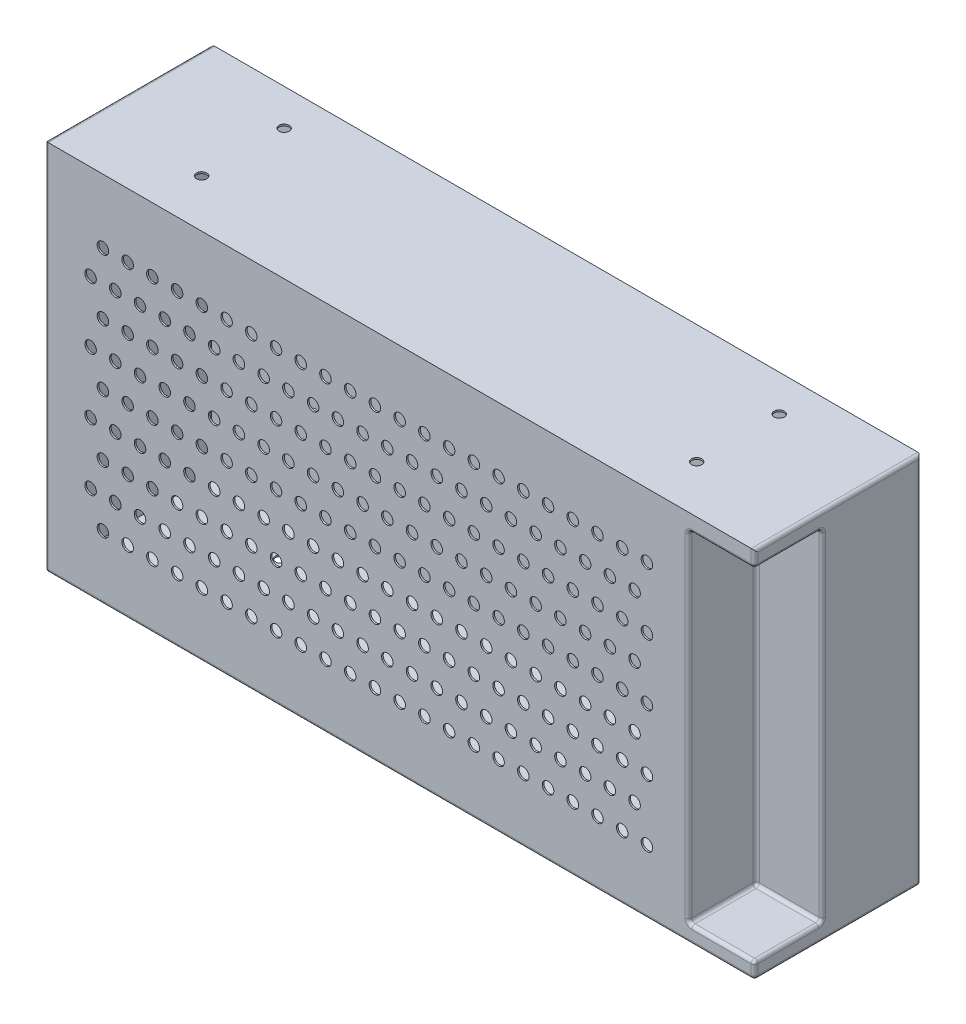
from build123d import *

# Parameters (mm, degrees)
CROQUIS1_W                  = 215
CROQUIS1_H                  = 113
SALIENTE_EXTRUIR1_DEPTH     = 50
CROQUIS2_W                  = 20
CROQUIS2_H                  = 103
CORTAR_EXTRUIR1_DEPTH       = 20
VACIADO1_START              = -107
VACIADO1_OUTLINE_W          = 112
VACIADO1_OUTLINE_H          = 49.5
VACIADO1_DEPTH              = 194
VACIADO1_START_2            = 87
VACIADO1_2_DEPTH            = 20
SALIENTE_EXTRUIR2_DEPTH     = 0.5
CROQUIS5_R                  = 1.75
CORTAR_EXTRUIR2_DEPTH       = 1
PATR_N_START                = 50
PATR_N_DE_RAYADO1_OUTLINE_R = 1.75
PATR_N_DE_RAYADO1_DEPTH     = 0.5
CROQUIS6_R                  = 1.6
CORTAR_EXTRUIR3_DEPTH       = 0.5
CROQUIS7_R                  = 1.55
CORTAR_EXTRUIR4_DEPTH       = 0.5
MATRIZL1_COUNT              = 2
MATRIZL1_PITCH              = 150
MATRIZL1_COUNT_DIR2         = 2
MATRIZL1_PITCH_DIR2         = 25
CROQUIS8_R                  = 1.6
CORTAR_EXTRUIR5_DEPTH       = 0.5
MATRIZL2_COUNT              = 2
MATRIZL2_PITCH              = 150
MATRIZL2_COUNT_DIR2         = 2
MATRIZL2_PITCH_DIR2         = 50
REDONDEO1_R                 = 1


# Read off the part's stored shape, not the designer's step: Vaciado1, Patrón de rayado1
with BuildPart() as part:
    # Croquis1 → Saliente-Extruir1 (new body)
    with BuildSketch(Plane.XY):
        Rectangle(CROQUIS1_W, CROQUIS1_H)
    extrude(amount=SALIENTE_EXTRUIR1_DEPTH)

    # Croquis2 → Cortar-Extruir1 (cut)
    with BuildSketch(Plane(origin=(107.5, 0, 0), x_dir=(0, 0, -1), z_dir=(1, 0, 0))):
        with Locations((-40, 0)):
            Rectangle(CROQUIS2_W, CROQUIS2_H)
    extrude(amount=-CORTAR_EXTRUIR1_DEPTH, mode=Mode.SUBTRACT)

    # Vaciado1 outline → Vaciado1 (cut)
    with BuildSketch(Plane.YZ.offset(VACIADO1_START)):
        with Locations((0, 25.25)):
            Rectangle(VACIADO1_OUTLINE_W, VACIADO1_OUTLINE_H)
    extrude(amount=VACIADO1_DEPTH, mode=Mode.SUBTRACT)

    # Vaciado1 2 outline → Vaciado1 2 (cut)
    with BuildSketch(Plane.YZ.offset(VACIADO1_START_2)):
        Polygon((-56, 50), (-56, 0.5), (56, 0.5), (56, 50), (52, 50), (52, 29.5), (-52, 29.5), (-52, 50), align=None)
    extrude(amount=VACIADO1_2_DEPTH, mode=Mode.SUBTRACT)

    # Croquis4 → Saliente-Extruir2 (add)
    with BuildSketch(Plane.XY.offset(50)):
        Polygon((-107.5, 56.5), (107.5, 56.5), (107.5, 51.5), (87.5, 51.5), (87.5, -51.5), (107.5, -51.5), (107.5, -56.5), (-107.5, -56.5), align=None)
    extrude(amount=SALIENTE_EXTRUIR2_DEPTH)

    # Croquis5 → Cortar-Extruir2 (cut)
    with BuildSketch(Plane.XY.offset(50.5)):
        Circle(CROQUIS5_R)
    extrude(amount=-CORTAR_EXTRUIR2_DEPTH, mode=Mode.SUBTRACT)

    # Patrón de rayado1 outline → Patrón de rayado1 (cut)
    with BuildSketch(Plane.XY.offset(PATR_N_START)):
        with Locations((-93.651648354, 27.815515637)):
            Circle(PATR_N_DE_RAYADO1_OUTLINE_R)
        with Locations((37.460659342, -37.087354183)):
            Circle(PATR_N_DE_RAYADO1_OUTLINE_R)
        with Locations((59.937054947, 37.087354183)):
            Circle(PATR_N_DE_RAYADO1_OUTLINE_R)
        with Locations((56.190989012, 27.815515637)):
            Circle(PATR_N_DE_RAYADO1_OUTLINE_R)
        with Locations((52.444923078, 18.543677091)):
            Circle(PATR_N_DE_RAYADO1_OUTLINE_R)
        with Locations((41.206725276, -27.815515637)):
            Circle(PATR_N_DE_RAYADO1_OUTLINE_R)
        with Locations((44.95279121, -18.543677091)):
            Circle(PATR_N_DE_RAYADO1_OUTLINE_R)
        with Locations((48.698857144, -9.271838546)):
            Circle(PATR_N_DE_RAYADO1_OUTLINE_R)
        with Locations((52.444923078, 0)):
            Circle(PATR_N_DE_RAYADO1_OUTLINE_R)
        with Locations((48.698857144, 27.815515637)):
            Circle(PATR_N_DE_RAYADO1_OUTLINE_R)
        with Locations((52.444923078, 37.087354183)):
            Circle(PATR_N_DE_RAYADO1_OUTLINE_R)
        with Locations((29.968527473, -37.087354183)):
            Circle(PATR_N_DE_RAYADO1_OUTLINE_R)
        with Locations((33.714593407, -27.815515637)):
            Circle(PATR_N_DE_RAYADO1_OUTLINE_R)
        with Locations((37.460659342, -18.543677091)):
            Circle(PATR_N_DE_RAYADO1_OUTLINE_R)
        with Locations((41.206725276, -9.271838546)):
            Circle(PATR_N_DE_RAYADO1_OUTLINE_R)
        with Locations((44.95279121, 0)):
            Circle(PATR_N_DE_RAYADO1_OUTLINE_R)
        with Locations((48.698857144, 9.271838546)):
            Circle(PATR_N_DE_RAYADO1_OUTLINE_R)
        with Locations((59.937054947, 0)):
            Circle(PATR_N_DE_RAYADO1_OUTLINE_R)
        with Locations((63.683120881, 9.271838546)):
            Circle(PATR_N_DE_RAYADO1_OUTLINE_R)
        with Locations((67.429186815, 18.543677091)):
            Circle(PATR_N_DE_RAYADO1_OUTLINE_R)
        with Locations((71.175252749, 27.815515637)):
            Circle(PATR_N_DE_RAYADO1_OUTLINE_R)
        with Locations((59.937054947, -18.543677091)):
            Circle(PATR_N_DE_RAYADO1_OUTLINE_R)
        with Locations((56.190989012, -27.815515637)):
            Circle(PATR_N_DE_RAYADO1_OUTLINE_R)
        with Locations((52.444923078, -37.087354183)):
            Circle(PATR_N_DE_RAYADO1_OUTLINE_R)
        with Locations((74.921318683, 37.087354183)):
            Circle(PATR_N_DE_RAYADO1_OUTLINE_R)
        with Locations((56.190989012, -9.271838546)):
            Circle(PATR_N_DE_RAYADO1_OUTLINE_R)
        with Locations((52.444923078, -18.543677091)):
            Circle(PATR_N_DE_RAYADO1_OUTLINE_R)
        with Locations((48.698857144, -27.815515637)):
            Circle(PATR_N_DE_RAYADO1_OUTLINE_R)
        with Locations((44.95279121, -37.087354183)):
            Circle(PATR_N_DE_RAYADO1_OUTLINE_R)
        with Locations((67.429186815, 37.087354183)):
            Circle(PATR_N_DE_RAYADO1_OUTLINE_R)
        with Locations((63.683120881, 27.815515637)):
            Circle(PATR_N_DE_RAYADO1_OUTLINE_R)
        with Locations((59.937054947, 18.543677091)):
            Circle(PATR_N_DE_RAYADO1_OUTLINE_R)
        with Locations((56.190989012, 9.271838546)):
            Circle(PATR_N_DE_RAYADO1_OUTLINE_R)
        with Locations((37.460659342, 37.087354183)):
            Circle(PATR_N_DE_RAYADO1_OUTLINE_R)
        with Locations((33.714593407, 27.815515637)):
            Circle(PATR_N_DE_RAYADO1_OUTLINE_R)
        with Locations((29.968527473, 18.543677091)):
            Circle(PATR_N_DE_RAYADO1_OUTLINE_R)
        with Locations((26.222461539, 9.271838546)):
            Circle(PATR_N_DE_RAYADO1_OUTLINE_R)
        with Locations((22.476395605, 0)):
            Circle(PATR_N_DE_RAYADO1_OUTLINE_R)
        with Locations((18.730329671, -9.271838546)):
            Circle(PATR_N_DE_RAYADO1_OUTLINE_R)
        with Locations((14.984263737, -18.543677091)):
            Circle(PATR_N_DE_RAYADO1_OUTLINE_R)
        with Locations((11.238197802, -27.815515637)):
            Circle(PATR_N_DE_RAYADO1_OUTLINE_R)
        with Locations((7.492131868, -18.543677091)):
            Circle(PATR_N_DE_RAYADO1_OUTLINE_R)
        with Locations((11.238197802, -9.271838546)):
            Circle(PATR_N_DE_RAYADO1_OUTLINE_R)
        with Locations((14.984263737, 0)):
            Circle(PATR_N_DE_RAYADO1_OUTLINE_R)
        with Locations((18.730329671, 9.271838546)):
            Circle(PATR_N_DE_RAYADO1_OUTLINE_R)
        with Locations((7.492131868, -37.087354183)):
            Circle(PATR_N_DE_RAYADO1_OUTLINE_R)
        with Locations((29.968527473, 37.087354183)):
            Circle(PATR_N_DE_RAYADO1_OUTLINE_R)
        with Locations((26.222461539, 27.815515637)):
            Circle(PATR_N_DE_RAYADO1_OUTLINE_R)
        with Locations((22.476395605, 18.543677091)):
            Circle(PATR_N_DE_RAYADO1_OUTLINE_R)
        with Locations((29.968527473, -18.543677091)):
            Circle(PATR_N_DE_RAYADO1_OUTLINE_R)
        with Locations((26.222461539, -27.815515637)):
            Circle(PATR_N_DE_RAYADO1_OUTLINE_R)
        with Locations((22.476395605, -37.087354183)):
            Circle(PATR_N_DE_RAYADO1_OUTLINE_R)
        with Locations((44.95279121, 37.087354183)):
            Circle(PATR_N_DE_RAYADO1_OUTLINE_R)
        with Locations((33.714593407, -9.271838546)):
            Circle(PATR_N_DE_RAYADO1_OUTLINE_R)
        with Locations((37.460659342, 0)):
            Circle(PATR_N_DE_RAYADO1_OUTLINE_R)
        with Locations((41.206725276, 9.271838546)):
            Circle(PATR_N_DE_RAYADO1_OUTLINE_R)
        with Locations((44.95279121, 18.543677091)):
            Circle(PATR_N_DE_RAYADO1_OUTLINE_R)
        with Locations((41.206725276, 27.815515637)):
            Circle(PATR_N_DE_RAYADO1_OUTLINE_R)
        with Locations((37.460659342, 18.543677091)):
            Circle(PATR_N_DE_RAYADO1_OUTLINE_R)
        with Locations((33.714593407, 9.271838546)):
            Circle(PATR_N_DE_RAYADO1_OUTLINE_R)
        with Locations((29.968527473, 0)):
            Circle(PATR_N_DE_RAYADO1_OUTLINE_R)
        with Locations((26.222461539, -9.271838546)):
            Circle(PATR_N_DE_RAYADO1_OUTLINE_R)
        with Locations((22.476395605, -18.543677091)):
            Circle(PATR_N_DE_RAYADO1_OUTLINE_R)
        with Locations((18.730329671, -27.815515637)):
            Circle(PATR_N_DE_RAYADO1_OUTLINE_R)
        with Locations((14.984263737, -37.087354183)):
            Circle(PATR_N_DE_RAYADO1_OUTLINE_R)
        with Locations((74.921318683, -18.543677091)):
            Circle(PATR_N_DE_RAYADO1_OUTLINE_R)
        with Locations((71.175252749, -27.815515637)):
            Circle(PATR_N_DE_RAYADO1_OUTLINE_R)
        with Locations((67.429186815, -37.087354183)):
            Circle(PATR_N_DE_RAYADO1_OUTLINE_R)
        with Locations((74.921318683, 0)):
            Circle(PATR_N_DE_RAYADO1_OUTLINE_R)
        with Locations((74.921318683, -37.087354183)):
            Circle(PATR_N_DE_RAYADO1_OUTLINE_R)
        with Locations((63.683120881, -9.271838546)):
            Circle(PATR_N_DE_RAYADO1_OUTLINE_R)
        with Locations((67.429186815, 0)):
            Circle(PATR_N_DE_RAYADO1_OUTLINE_R)
        with Locations((71.175252749, 9.271838546)):
            Circle(PATR_N_DE_RAYADO1_OUTLINE_R)
        with Locations((74.921318683, 18.543677091)):
            Circle(PATR_N_DE_RAYADO1_OUTLINE_R)
        with Locations((59.937054947, -37.087354183)):
            Circle(PATR_N_DE_RAYADO1_OUTLINE_R)
        with Locations((63.683120881, -27.815515637)):
            Circle(PATR_N_DE_RAYADO1_OUTLINE_R)
        with Locations((67.429186815, -18.543677091)):
            Circle(PATR_N_DE_RAYADO1_OUTLINE_R)
        with Locations((71.175252749, -9.271838546)):
            Circle(PATR_N_DE_RAYADO1_OUTLINE_R)
        with Locations((-63.683120881, -9.271838546)):
            Circle(PATR_N_DE_RAYADO1_OUTLINE_R)
        with Locations((-59.937054947, 0)):
            Circle(PATR_N_DE_RAYADO1_OUTLINE_R)
        with Locations((-56.190989012, 9.271838546)):
            Circle(PATR_N_DE_RAYADO1_OUTLINE_R)
        with Locations((-52.444923078, 18.543677091)):
            Circle(PATR_N_DE_RAYADO1_OUTLINE_R)
        with Locations((-48.698857144, 27.815515637)):
            Circle(PATR_N_DE_RAYADO1_OUTLINE_R)
        with Locations((-44.95279121, 37.087354183)):
            Circle(PATR_N_DE_RAYADO1_OUTLINE_R)
        with Locations((-67.429186815, -37.087354183)):
            Circle(PATR_N_DE_RAYADO1_OUTLINE_R)
        with Locations((-63.683120881, -27.815515637)):
            Circle(PATR_N_DE_RAYADO1_OUTLINE_R)
        with Locations((-67.429186815, 0)):
            Circle(PATR_N_DE_RAYADO1_OUTLINE_R)
        with Locations((-63.683120881, 9.271838546)):
            Circle(PATR_N_DE_RAYADO1_OUTLINE_R)
        with Locations((-59.937054947, 18.543677091)):
            Circle(PATR_N_DE_RAYADO1_OUTLINE_R)
        with Locations((-56.190989012, 27.815515637)):
            Circle(PATR_N_DE_RAYADO1_OUTLINE_R)
        with Locations((-67.429186815, -18.543677091)):
            Circle(PATR_N_DE_RAYADO1_OUTLINE_R)
        with Locations((-71.175252749, -27.815515637)):
            Circle(PATR_N_DE_RAYADO1_OUTLINE_R)
        with Locations((-74.921318683, -37.087354183)):
            Circle(PATR_N_DE_RAYADO1_OUTLINE_R)
        with Locations((-52.444923078, 37.087354183)):
            Circle(PATR_N_DE_RAYADO1_OUTLINE_R)
        with Locations((-29.968527473, 37.087354183)):
            Circle(PATR_N_DE_RAYADO1_OUTLINE_R)
        with Locations((-33.714593407, 27.815515637)):
            Circle(PATR_N_DE_RAYADO1_OUTLINE_R)
        with Locations((-37.460659342, 18.543677091)):
            Circle(PATR_N_DE_RAYADO1_OUTLINE_R)
        with Locations((-41.206725276, 9.271838546)):
            Circle(PATR_N_DE_RAYADO1_OUTLINE_R)
        with Locations((-44.95279121, 0)):
            Circle(PATR_N_DE_RAYADO1_OUTLINE_R)
        with Locations((-48.698857144, -9.271838546)):
            Circle(PATR_N_DE_RAYADO1_OUTLINE_R)
        with Locations((-52.444923078, -18.543677091)):
            Circle(PATR_N_DE_RAYADO1_OUTLINE_R)
        with Locations((-56.190989012, -27.815515637)):
            Circle(PATR_N_DE_RAYADO1_OUTLINE_R)
        with Locations((-59.937054947, -18.543677091)):
            Circle(PATR_N_DE_RAYADO1_OUTLINE_R)
        with Locations((-56.190989012, -9.271838546)):
            Circle(PATR_N_DE_RAYADO1_OUTLINE_R)
        with Locations((-52.444923078, 0)):
            Circle(PATR_N_DE_RAYADO1_OUTLINE_R)
        with Locations((-48.698857144, 9.271838546)):
            Circle(PATR_N_DE_RAYADO1_OUTLINE_R)
        with Locations((-59.937054947, -37.087354183)):
            Circle(PATR_N_DE_RAYADO1_OUTLINE_R)
        with Locations((-37.460659342, 37.087354183)):
            Circle(PATR_N_DE_RAYADO1_OUTLINE_R)
        with Locations((-41.206725276, 27.815515637)):
            Circle(PATR_N_DE_RAYADO1_OUTLINE_R)
        with Locations((-44.95279121, 18.543677091)):
            Circle(PATR_N_DE_RAYADO1_OUTLINE_R)
        with Locations((-93.651648354, -27.815515637)):
            Circle(PATR_N_DE_RAYADO1_OUTLINE_R)
        with Locations((-74.921318683, 37.087354183)):
            Circle(PATR_N_DE_RAYADO1_OUTLINE_R)
        with Locations((-78.667384617, 27.815515637)):
            Circle(PATR_N_DE_RAYADO1_OUTLINE_R)
        with Locations((-82.413450552, 18.543677091)):
            Circle(PATR_N_DE_RAYADO1_OUTLINE_R)
        with Locations((-89.90558242, -18.543677091)):
            Circle(PATR_N_DE_RAYADO1_OUTLINE_R)
        with Locations((-86.159516486, -9.271838546)):
            Circle(PATR_N_DE_RAYADO1_OUTLINE_R)
        with Locations((-82.413450552, 0)):
            Circle(PATR_N_DE_RAYADO1_OUTLINE_R)
        with Locations((-78.667384617, 9.271838546)):
            Circle(PATR_N_DE_RAYADO1_OUTLINE_R)
        with Locations((-86.159516486, 27.815515637)):
            Circle(PATR_N_DE_RAYADO1_OUTLINE_R)
        with Locations((-89.90558242, 18.543677091)):
            Circle(PATR_N_DE_RAYADO1_OUTLINE_R)
        with Locations((-93.651648354, 9.271838546)):
            Circle(PATR_N_DE_RAYADO1_OUTLINE_R)
        with Locations((-89.90558242, 37.087354183)):
            Circle(PATR_N_DE_RAYADO1_OUTLINE_R)
        with Locations((-86.159516486, 9.271838546)):
            Circle(PATR_N_DE_RAYADO1_OUTLINE_R)
        with Locations((-89.90558242, 0)):
            Circle(PATR_N_DE_RAYADO1_OUTLINE_R)
        with Locations((-93.651648354, -9.271838546)):
            Circle(PATR_N_DE_RAYADO1_OUTLINE_R)
        with Locations((-82.413450552, 37.087354183)):
            Circle(PATR_N_DE_RAYADO1_OUTLINE_R)
        with Locations((-71.175252749, -9.271838546)):
            Circle(PATR_N_DE_RAYADO1_OUTLINE_R)
        with Locations((-74.921318683, -18.543677091)):
            Circle(PATR_N_DE_RAYADO1_OUTLINE_R)
        with Locations((-78.667384617, -27.815515637)):
            Circle(PATR_N_DE_RAYADO1_OUTLINE_R)
        with Locations((-82.413450552, -37.087354183)):
            Circle(PATR_N_DE_RAYADO1_OUTLINE_R)
        with Locations((-59.937054947, 37.087354183)):
            Circle(PATR_N_DE_RAYADO1_OUTLINE_R)
        with Locations((-63.683120881, 27.815515637)):
            Circle(PATR_N_DE_RAYADO1_OUTLINE_R)
        with Locations((-67.429186815, 18.543677091)):
            Circle(PATR_N_DE_RAYADO1_OUTLINE_R)
        with Locations((-71.175252749, 9.271838546)):
            Circle(PATR_N_DE_RAYADO1_OUTLINE_R)
        with Locations((-89.90558242, -37.087354183)):
            Circle(PATR_N_DE_RAYADO1_OUTLINE_R)
        with Locations((-67.429186815, 37.087354183)):
            Circle(PATR_N_DE_RAYADO1_OUTLINE_R)
        with Locations((-71.175252749, 27.815515637)):
            Circle(PATR_N_DE_RAYADO1_OUTLINE_R)
        with Locations((-74.921318683, 18.543677091)):
            Circle(PATR_N_DE_RAYADO1_OUTLINE_R)
        with Locations((-86.159516486, -27.815515637)):
            Circle(PATR_N_DE_RAYADO1_OUTLINE_R)
        with Locations((-82.413450552, -18.543677091)):
            Circle(PATR_N_DE_RAYADO1_OUTLINE_R)
        with Locations((-78.667384617, -9.271838546)):
            Circle(PATR_N_DE_RAYADO1_OUTLINE_R)
        with Locations((-74.921318683, 0)):
            Circle(PATR_N_DE_RAYADO1_OUTLINE_R)
        with Locations((-7.492131868, 0)):
            Circle(PATR_N_DE_RAYADO1_OUTLINE_R)
        with Locations((-3.746065934, 9.271838546)):
            Circle(PATR_N_DE_RAYADO1_OUTLINE_R)
        with Locations((0, 18.543677091)):
            Circle(PATR_N_DE_RAYADO1_OUTLINE_R)
        with Locations((3.746065934, 27.815515637)):
            Circle(PATR_N_DE_RAYADO1_OUTLINE_R)
        with Locations((-7.492131868, -18.543677091)):
            Circle(PATR_N_DE_RAYADO1_OUTLINE_R)
        with Locations((-11.238197802, -27.815515637)):
            Circle(PATR_N_DE_RAYADO1_OUTLINE_R)
        with Locations((-14.984263737, -37.087354183)):
            Circle(PATR_N_DE_RAYADO1_OUTLINE_R)
        with Locations((7.492131868, 37.087354183)):
            Circle(PATR_N_DE_RAYADO1_OUTLINE_R)
        with Locations((-11.238197802, -9.271838546)):
            Circle(PATR_N_DE_RAYADO1_OUTLINE_R)
        with Locations((-14.984263737, -18.543677091)):
            Circle(PATR_N_DE_RAYADO1_OUTLINE_R)
        with Locations((-18.730329671, -27.815515637)):
            Circle(PATR_N_DE_RAYADO1_OUTLINE_R)
        with Locations((-22.476395605, -37.087354183)):
            Circle(PATR_N_DE_RAYADO1_OUTLINE_R)
        with Locations((0, 37.087354183)):
            Circle(PATR_N_DE_RAYADO1_OUTLINE_R)
        with Locations((-3.746065934, 27.815515637)):
            Circle(PATR_N_DE_RAYADO1_OUTLINE_R)
        with Locations((-7.492131868, 18.543677091)):
            Circle(PATR_N_DE_RAYADO1_OUTLINE_R)
        with Locations((-11.238197802, 9.271838546)):
            Circle(PATR_N_DE_RAYADO1_OUTLINE_R)
        with Locations((3.746065934, -9.271838546)):
            Circle(PATR_N_DE_RAYADO1_OUTLINE_R)
        with Locations((7.492131868, 0)):
            Circle(PATR_N_DE_RAYADO1_OUTLINE_R)
        with Locations((11.238197802, 9.271838546)):
            Circle(PATR_N_DE_RAYADO1_OUTLINE_R)
        with Locations((14.984263737, 18.543677091)):
            Circle(PATR_N_DE_RAYADO1_OUTLINE_R)
        with Locations((18.730329671, 27.815515637)):
            Circle(PATR_N_DE_RAYADO1_OUTLINE_R)
        with Locations((22.476395605, 37.087354183)):
            Circle(PATR_N_DE_RAYADO1_OUTLINE_R)
        with Locations((0, -37.087354183)):
            Circle(PATR_N_DE_RAYADO1_OUTLINE_R)
        with Locations((3.746065934, -27.815515637)):
            Circle(PATR_N_DE_RAYADO1_OUTLINE_R)
        with Locations((-3.746065934, -9.271838546)):
            Circle(PATR_N_DE_RAYADO1_OUTLINE_R)
        with Locations((3.746065934, 9.271838546)):
            Circle(PATR_N_DE_RAYADO1_OUTLINE_R)
        with Locations((7.492131868, 18.543677091)):
            Circle(PATR_N_DE_RAYADO1_OUTLINE_R)
        with Locations((11.238197802, 27.815515637)):
            Circle(PATR_N_DE_RAYADO1_OUTLINE_R)
        with Locations((0, -18.543677091)):
            Circle(PATR_N_DE_RAYADO1_OUTLINE_R)
        with Locations((-3.746065934, -27.815515637)):
            Circle(PATR_N_DE_RAYADO1_OUTLINE_R)
        with Locations((-7.492131868, -37.087354183)):
            Circle(PATR_N_DE_RAYADO1_OUTLINE_R)
        with Locations((14.984263737, 37.087354183)):
            Circle(PATR_N_DE_RAYADO1_OUTLINE_R)
        with Locations((-37.460659342, -18.543677091)):
            Circle(PATR_N_DE_RAYADO1_OUTLINE_R)
        with Locations((-41.206725276, -27.815515637)):
            Circle(PATR_N_DE_RAYADO1_OUTLINE_R)
        with Locations((-44.95279121, -37.087354183)):
            Circle(PATR_N_DE_RAYADO1_OUTLINE_R)
        with Locations((-22.476395605, 37.087354183)):
            Circle(PATR_N_DE_RAYADO1_OUTLINE_R)
        with Locations((-33.714593407, -9.271838546)):
            Circle(PATR_N_DE_RAYADO1_OUTLINE_R)
        with Locations((-29.968527473, 0)):
            Circle(PATR_N_DE_RAYADO1_OUTLINE_R)
        with Locations((-26.222461539, 9.271838546)):
            Circle(PATR_N_DE_RAYADO1_OUTLINE_R)
        with Locations((-22.476395605, 18.543677091)):
            Circle(PATR_N_DE_RAYADO1_OUTLINE_R)
        with Locations((-26.222461539, 27.815515637)):
            Circle(PATR_N_DE_RAYADO1_OUTLINE_R)
        with Locations((-29.968527473, 18.543677091)):
            Circle(PATR_N_DE_RAYADO1_OUTLINE_R)
        with Locations((-33.714593407, 9.271838546)):
            Circle(PATR_N_DE_RAYADO1_OUTLINE_R)
        with Locations((-37.460659342, 0)):
            Circle(PATR_N_DE_RAYADO1_OUTLINE_R)
        with Locations((-41.206725276, -9.271838546)):
            Circle(PATR_N_DE_RAYADO1_OUTLINE_R)
        with Locations((-44.95279121, -18.543677091)):
            Circle(PATR_N_DE_RAYADO1_OUTLINE_R)
        with Locations((-48.698857144, -27.815515637)):
            Circle(PATR_N_DE_RAYADO1_OUTLINE_R)
        with Locations((-52.444923078, -37.087354183)):
            Circle(PATR_N_DE_RAYADO1_OUTLINE_R)
        with Locations((-29.968527473, -37.087354183)):
            Circle(PATR_N_DE_RAYADO1_OUTLINE_R)
        with Locations((-7.492131868, 37.087354183)):
            Circle(PATR_N_DE_RAYADO1_OUTLINE_R)
        with Locations((-11.238197802, 27.815515637)):
            Circle(PATR_N_DE_RAYADO1_OUTLINE_R)
        with Locations((-14.984263737, 18.543677091)):
            Circle(PATR_N_DE_RAYADO1_OUTLINE_R)
        with Locations((-26.222461539, -27.815515637)):
            Circle(PATR_N_DE_RAYADO1_OUTLINE_R)
        with Locations((-22.476395605, -18.543677091)):
            Circle(PATR_N_DE_RAYADO1_OUTLINE_R)
        with Locations((-18.730329671, -9.271838546)):
            Circle(PATR_N_DE_RAYADO1_OUTLINE_R)
        with Locations((-14.984263737, 0)):
            Circle(PATR_N_DE_RAYADO1_OUTLINE_R)
        with Locations((-18.730329671, 27.815515637)):
            Circle(PATR_N_DE_RAYADO1_OUTLINE_R)
        with Locations((-14.984263737, 37.087354183)):
            Circle(PATR_N_DE_RAYADO1_OUTLINE_R)
        with Locations((-37.460659342, -37.087354183)):
            Circle(PATR_N_DE_RAYADO1_OUTLINE_R)
        with Locations((-33.714593407, -27.815515637)):
            Circle(PATR_N_DE_RAYADO1_OUTLINE_R)
        with Locations((-29.968527473, -18.543677091)):
            Circle(PATR_N_DE_RAYADO1_OUTLINE_R)
        with Locations((-26.222461539, -9.271838546)):
            Circle(PATR_N_DE_RAYADO1_OUTLINE_R)
        with Locations((-22.476395605, 0)):
            Circle(PATR_N_DE_RAYADO1_OUTLINE_R)
        with Locations((-18.730329671, 9.271838546)):
            Circle(PATR_N_DE_RAYADO1_OUTLINE_R)
    extrude(amount=PATR_N_DE_RAYADO1_DEPTH, mode=Mode.SUBTRACT)

    # Croquis6 → Cortar-Extruir3 (cut)
    with BuildSketch(Plane.XZ.offset(56.5)):
        with Locations((-74.497006981, 12)):
            Circle(CROQUIS6_R)
        with Locations((75.5, 11.052425914)):
            Circle(CROQUIS6_R)
    extrude(amount=-CORTAR_EXTRUIR3_DEPTH, mode=Mode.SUBTRACT)

    # Croquis7 → Cortar-Extruir4 (cut)
    with BuildSketch(Plane(origin=(0, 56.5, 0), x_dir=(1, 0, 0), z_dir=(0, 1, 0))):
        with Locations(Location((-74.5, -11, 0), (0, 0, 270))):
            Circle(CROQUIS7_R)
    cortar_extruir4 = extrude(amount=-CORTAR_EXTRUIR4_DEPTH, mode=Mode.SUBTRACT)

    # MatrizL1: Cortar-Extruir4 2 × 2
    with Locations(*[(i * MATRIZL1_PITCH, 0, j * MATRIZL1_PITCH_DIR2) for i in range(MATRIZL1_COUNT) for j in range(MATRIZL1_COUNT_DIR2) if (i, j) != (0, 0)]):
        add(cortar_extruir4, mode=Mode.SUBTRACT)

    # Croquis8 → Cortar-Extruir5 (cut)
    with BuildSketch(Plane(origin=(0, 0, 0), x_dir=(-1, 0, 0), z_dir=(0, 0, -1))):
        with Locations((75.5, -24.5)):
            Circle(CROQUIS8_R)
    cortar_extruir5 = extrude(amount=-CORTAR_EXTRUIR5_DEPTH, mode=Mode.SUBTRACT)

    # MatrizL2: Cortar-Extruir5 2 × 2
    with Locations(*[(i * MATRIZL2_PITCH, j * MATRIZL2_PITCH_DIR2, 0) for i in range(MATRIZL2_COUNT) for j in range(MATRIZL2_COUNT_DIR2) if (i, j) != (0, 0)]):
        add(cortar_extruir5, mode=Mode.SUBTRACT)

    # Redondeo1
    redondeo1_edges = [part.edges().sort_by_distance(p)[0] for p in [
        (87.5, 51.5, 40.25),
        (87.5, 0, 30),
        (97.5, 51.5, 30),
        (87.5, -51.5, 40.25),
        (97.5, -51.5, 30),
        (107.5, -51.5, 40.25),
        (107.5, 0, 30),
        (107.5, 51.5, 40.25),
        (0, 56, 0.5),
        (0, 56, 50),
        (87, 0, 50),
        (-107.5, 0, 50.5),
        (0, -56.5, 50.5),
        (107.5, -54, 50.5),
        (97.5, -51.5, 50.5),
        (87.5, 0, 50.5),
        (97.5, 51.5, 50.5),
        (107.5, 54, 50.5),
        (107.5, 0, 0),
        (0, -56.5, 0),
        (-107.5, 0, 0),
        (-107.5, 56.5, 25.25),
        (107.5, 56.5, 25.25),
        (107.5, -56.5, 25.25),
        (-107.5, -56.5, 25.25),
    ]]
    fillet(redondeo1_edges, radius=REDONDEO1_R)


solid = part.part
